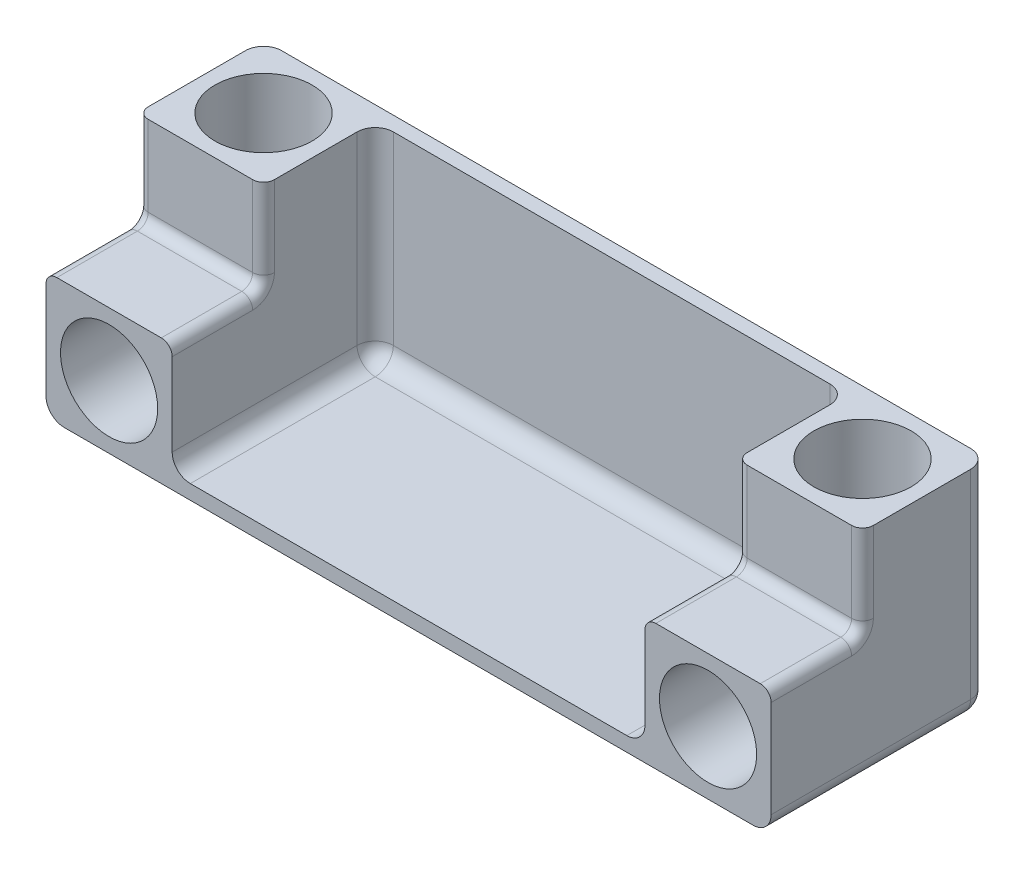
from build123d import *

# Parameters (mm, degrees)
SKETCH1_R           = 13.4
BOSS_EXTRUDE1_DEPTH = 56
SKETCH2_W           = 100
SKETCH2_H           = 60
BOSS_EXTRUDE2_DEPTH = 4
SKETCH3_R           = 13.4
CUT_EXTRUDE1_DEPTH  = 25.2
SKETCH4_W           = 25.2
SKETCH4_H           = 25.2
CUT_EXTRUDE2_DEPTH  = 51.2
FILLET1_R           = 5
FILLET2_R           = 5
FILLET4_R           = 3
FILLET5_R           = 3


with BuildPart() as part:
    # Sketch1 → Boss-Extrude1 (new body)
    with BuildSketch(Plane(origin=(0, 0, 0), x_dir=(1, 0, 0), z_dir=(0, 1, 0))):
        Polygon((-65.2, -11.320132013), (-65.2, 44.679867987), (0, 44.679867987), (0, 48.679867987), (-100, 48.679867987), (-100, -11.320132013), align=None)
        with Locations((-82.6, 31.279867987)):
            Circle(SKETCH1_R, mode=Mode.SUBTRACT)
    boss_extrude1 = extrude(amount=BOSS_EXTRUDE1_DEPTH)

    # Sketch2 → Boss-Extrude2 (add)
    with BuildSketch(Plane(origin=(0, 0, 0), x_dir=(1, 0, 0), z_dir=(0, 1, 0))):
        with Locations((-50, 18.679867987)):
            Rectangle(SKETCH2_W, SKETCH2_H)
    boss_extrude2 = extrude(amount=-BOSS_EXTRUDE2_DEPTH)

    # Sketch3 → Cut-Extrude1 (cut)
    with BuildSketch(Plane.XY.offset(11.320132013)):
        with Locations((-82.6, 13.4)):
            Circle(SKETCH3_R)
    cut_extrude1 = extrude(amount=-CUT_EXTRUDE1_DEPTH, mode=Mode.SUBTRACT)

    # Sketch4 → Cut-Extrude2 (cut)
    with BuildSketch(Plane.ZY.offset(100)):
        with Locations((-1.279867987, 43.4)):
            Rectangle(SKETCH4_W, SKETCH4_H)
    cut_extrude2 = extrude(amount=-CUT_EXTRUDE2_DEPTH, mode=Mode.SUBTRACT)

    # Mirror2: Boss-Extrude1, Boss-Extrude2, Cut-Extrude1, Cut-Extrude2 across plane
    add(boss_extrude1.mirror(Plane.ZY))
    add(boss_extrude2.mirror(Plane.ZY))
    add(cut_extrude1.mirror(Plane.ZY), mode=Mode.SUBTRACT)
    add(cut_extrude2.mirror(Plane.ZY), mode=Mode.SUBTRACT)

    # Fillet1
    fillet1_edges = [part.edges().sort_by_distance(p)[0] for p in [
        (65.2, 0, -16.679867987),
        (65.2, 28, -44.679867987),
        (-65.2, 0, -16.679867987),
        (0, 0, -44.679867987),
        (-65.2, 28, -44.679867987),
    ]]
    fillet(fillet1_edges, radius=FILLET1_R)

    # Fillet2
    fillet2_edges = [part.edges().sort_by_distance(p)[0] for p in [
        (-100, -4, -18.679867987),
        (-100, 26, -48.679867987),
        (100, -4, -18.679867987),
        (0, -4, -48.679867987),
        (100, 26, -48.679867987),
    ]]
    fillet(fillet2_edges, radius=FILLET2_R)

    # Fillet4
    fillet4_edges = [part.edges().sort_by_distance(p)[0] for p in [
        (-65.2, 30.8, -1.279867987),
        (-100, 30.8, -1.279867987),
        (-82.6, 30.8, -13.879867987),
        (-100, 43.4, -13.879867987),
        (-65.2, 43.4, -13.879867987),
    ]]
    fillet(fillet4_edges, radius=FILLET4_R)

    # Fillet5
    fillet5_edges = [part.edges().sort_by_distance(p)[0] for p in [
        (100, 30.8, -1.279867987),
        (65.2, 30.8, -1.279867987),
        (100, 43.4, -13.879867987),
        (65.2, 43.4, -13.879867987),
        (82.6, 30.8, -13.879867987),
    ]]
    fillet(fillet5_edges, radius=FILLET5_R)


solid = part.part
